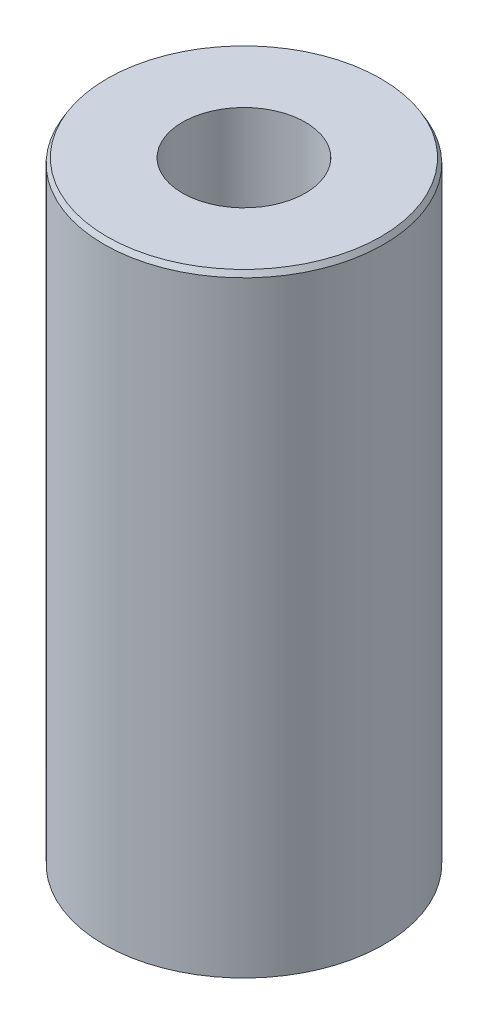
from build123d import *
from OCP.BRepFilletAPI import BRepFilletAPI_MakeChamfer

# Parameters (mm, degrees)
SKETCH1_R           = 15
BOSS_EXTRUDE1_DEPTH = 65.895036726
SKETCH2_R           = 6.590745623
CUT_EXTRUDE1_DEPTH  = 70.225398989
CHAMFER1_SIZE       = 0.555467817
CHAMFER1_SIZE2      = 0.320699494


with BuildPart() as part:
    # Sketch1 → Boss-Extrude1 (new body)
    with BuildSketch(Plane(origin=(0, 0, 0), x_dir=(1, 0, 0), z_dir=(0, 1, 0))):
        Circle(SKETCH1_R)
    extrude(amount=BOSS_EXTRUDE1_DEPTH)

    # Sketch2 → Cut-Extrude1 (cut, through all)
    with BuildSketch(Plane(origin=(0, 0, 0), x_dir=(1, 0, 0), z_dir=(0, 1, 0))):
        Circle(SKETCH2_R)
    extrude(amount=CUT_EXTRUDE1_DEPTH, mode=Mode.SUBTRACT)

    # Chamfer1: one chamfer whose edges measure the first distance from different faces: ONE call of the kernel's chamfer builder (chamfer() names one face for all edges)
    chamfer1_edges_1 = [part.edges().sort_by_distance(p)[0] for p in [
        (-15, 65.895036726, 0),
    ]]
    chamfer1_side_1 = [part.faces().sort_by_distance(p)[0] for p in [
        (-15, 32.947518363, 0),
    ]]
    chamfer1_edges_2 = [part.edges().sort_by_distance(p)[0] for p in [
        (-15, 0, 0),
    ]]
    chamfer1_side_2 = [part.faces().sort_by_distance(p)[0] for p in [
        (-14.575735931, 0, 0),
    ]]
    chamfer1 = BRepFilletAPI_MakeChamfer(part.part.solid().wrapped)
    for e in chamfer1_edges_1:
        chamfer1.Add(CHAMFER1_SIZE, CHAMFER1_SIZE2, e.wrapped, chamfer1_side_1[0].wrapped)  # the first distance lies on this face
    for e in chamfer1_edges_2:
        chamfer1.Add(CHAMFER1_SIZE, CHAMFER1_SIZE2, e.wrapped, chamfer1_side_2[0].wrapped)  # the first distance lies on this face
    add(Compound.cast(chamfer1.Shape()), mode=Mode.REPLACE)


solid = part.part
